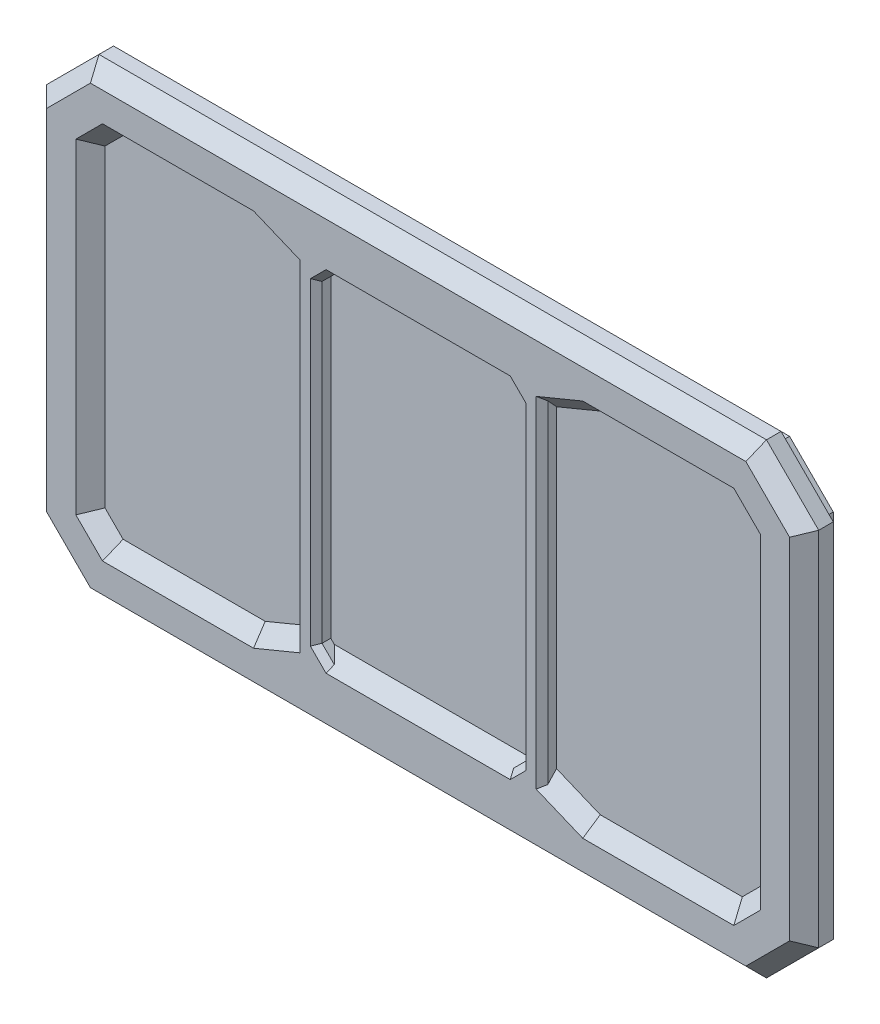
from build123d import *

# Parameters (mm, degrees)
BOSS_EXTRU_1_DEPTH      = 10
BOSS_EXTRU_2_DEPTH      = 20
ENL_V_MAT_EXTRU_1_DEPTH = 10
CHANFREIN1_SIZE         = 10
CHANFREIN2_SIZE         = 10
CHANFREIN3_SIZE         = 4


# Some blends are built 0.0001 mm under size
with BuildPart() as part:
    # Esquisse1 → Boss.-Extru.1 (new body)
    with BuildSketch(Plane.XY):
        Polygon((0, 270), (30, 300), (480, 300), (510, 270), (510, 30), (480, 0), (30, 0), (0, 30), align=None)
        Polygon((10, 265.857864376), (34.142135624, 290), (475.857864376, 290), (500, 265.857864376), (500, 34.142135624), (475.857864376, 10), (34.142135624, 10), (10, 34.142135624), align=None, mode=Mode.SUBTRACT)
    extrude(amount=BOSS_EXTRU_1_DEPTH)

    # Esquisse2 → Boss.-Extru.2 (add)
    with BuildSketch(Plane.XY.offset(10)):
        Polygon((484.142135624, 310), (25.857864376, 310), (-10, 274.142135624), (-10, 25.857864376), (25.857864376, -10), (484.142135624, -10), (520, 25.857864376), (520, 274.142135624), align=None)
    extrude(amount=BOSS_EXTRU_2_DEPTH)

    # Esquisse3 → Enlèv. mat.-Extru.1 (cut)
    with BuildSketch(Plane.XY.offset(30)):
        Polygon((42.426406871, 270), (140, 270), (170, 257.573593129), (170, 42.426406871), (140, 30), (42.426406871, 30), (30, 42.426406871), (30, 257.573593129), align=None)
        Polygon((480, 257.573593129), (467.573593129, 270), (370, 270), (340, 257.573593129), (340, 42.426406871), (370, 30), (467.573593129, 30), (480, 42.426406871), align=None)
        Polygon((197.426406871, 270), (185, 257.573593129), (185, 42.426406871), (197.426406871, 30), (312.573593129, 30), (325, 42.426406871), (325, 257.573593129), (312.573593129, 270), (255, 270), align=None)
    extrude(amount=-ENL_V_MAT_EXTRU_1_DEPTH, mode=Mode.SUBTRACT)

    # Chanfrein1
    chanfrein1_edges = [part.edges().sort_by_distance(p)[0] for p in [
        (520, 150, 30),
        (502.071067812, 7.928932188, 30),
        (255, -10, 30),
        (7.928932188, 7.928932188, 30),
        (-10, 150, 30),
        (7.928932188, 292.071067812, 30),
        (255, 310, 30),
        (502.071067812, 292.071067812, 30),
        (473.786796564, 263.786796564, 30),
        (418.786796564, 270, 30),
        (355, 263.786796564, 30),
        (355, 36.213203436, 30),
        (418.786796564, 30, 30),
        (473.786796564, 36.213203436, 30),
        (480, 150, 30),
        (155, 36.213203436, 30),
        (155, 263.786796564, 30),
        (91.213203436, 270, 30),
        (36.213203436, 263.786796564, 30),
        (30, 150, 30),
        (36.213203436, 36.213203436, 30),
        (91.213203436, 30, 30),
    ]]
    chamfer(chanfrein1_edges, length=CHANFREIN1_SIZE - 0.0001)  # a hair under: the kernel refuses the full size

    # Chanfrein2
    chanfrein2_edges = [part.edges().sort_by_distance(p)[0] for p in [
        (255, 30, 20),
        (255, 270, 20),
    ]]
    chamfer(chanfrein2_edges, length=CHANFREIN2_SIZE - 0.0001)  # a hair under: the kernel refuses the full size

    # Chanfrein3
    # the kernel refuses this chamfer: 4 mm, written as the material it takes off along each edge
    with BuildSketch(Plane(origin=(340, 21.315861156, 30), x_dir=(-0.9996219169112968, 0, 0.027495876610586605), z_dir=(0, 1, 0))) as chanfrein3_piece_1_section:
        Polygon((CHANFREIN3_SIZE * 0.999621916911, -CHANFREIN3_SIZE * 0.0274958766106), (-CHANFREIN3_SIZE * 0.0274958766106, -CHANFREIN3_SIZE * 0.999621916911), (0, 0), align=None)
    chanfrein3_piece_1 = extrude(amount=257.368277689, mode=Mode.PRIVATE)
    chanfrein3_piece_1 = split(chanfrein3_piece_1, bisect_by=Plane(origin=(318.097162936, 199.689892736, -25.095613192), z_dir=(0.27059805007309734, -0.6532814824381883, 0.707106781186548)), keep=Keep.TOP, mode=Mode.PRIVATE)
    chanfrein3_piece_1 = split(chanfrein3_piece_1, bisect_by=Plane(origin=(318.097162936, 100.310107264, -25.095613192), z_dir=(0.27059805007309695, 0.6532814824381893, 0.7071067811865472)), keep=Keep.TOP, mode=Mode.PRIVATE)
    add(chanfrein3_piece_1, mode=Mode.SUBTRACT)
    with BuildSketch(Plane(origin=(170, 278.684138844, 30), x_dir=(0.9996219169112968, 0, 0.027495876610586414), z_dir=(0, -1, 0))) as chanfrein3_piece_2_section:
        Polygon((CHANFREIN3_SIZE * 0.999621916911, -CHANFREIN3_SIZE * 0.0274958766106), (-CHANFREIN3_SIZE * 0.0274958766106, -CHANFREIN3_SIZE * 0.999621916911), (0, 0), align=None)
    chanfrein3_piece_2 = extrude(amount=257.368277689, mode=Mode.PRIVATE)
    chanfrein3_piece_2 = split(chanfrein3_piece_2, bisect_by=Plane(origin=(191.902837064, 100.310107264, -25.095613192), z_dir=(-0.27059805007309856, 0.6532814824381883, 0.7071067811865475)), keep=Keep.TOP, mode=Mode.PRIVATE)
    chanfrein3_piece_2 = split(chanfrein3_piece_2, bisect_by=Plane(origin=(191.902837064, 199.689892736, -25.095613192), z_dir=(-0.2705980500730966, -0.6532814824381884, 0.7071067811865482)), keep=Keep.TOP, mode=Mode.PRIVATE)
    add(chanfrein3_piece_2, mode=Mode.SUBTRACT)
    with BuildSketch(Plane(origin=(332.273817919, 250.299775209, 30), x_dir=(-0.019442520806006888, -0.019442520806006888, -0.999621916911297), z_dir=(-0.7071067811865476, 0.7071067811865476, 0))) as chanfrein3_piece_3_section:
        Polygon((CHANFREIN3_SIZE * 0.999621916911, -CHANFREIN3_SIZE * 0.0274958766106), (-CHANFREIN3_SIZE * 0.0274958766106, -CHANFREIN3_SIZE * 0.999621916911), (0, 0), align=None)
    chanfrein3_piece_3 = extrude(amount=38.147057033, mode=Mode.PRIVATE)
    chanfrein3_piece_3 = split(chanfrein3_piece_3, bisect_by=Plane(origin=(320.298394929, 266.355378959, 26.355278959), z_dir=(0, -0.7071067811865467, 0.7071067811865485)), keep=Keep.TOP, mode=Mode.PRIVATE)
    chanfrein3_piece_3 = split(chanfrein3_piece_3, bisect_by=Plane(origin=(320.298394929, 270, 28.707260693), z_dir=(0, -1, 0)), keep=Keep.TOP, mode=Mode.PRIVATE)
    chanfrein3_piece_3 = split(chanfrein3_piece_3, bisect_by=Plane(origin=(325, 264.003397225, 28.707260693), z_dir=(-1, 0, 0)), keep=Keep.TOP, mode=Mode.PRIVATE)
    add(chanfrein3_piece_3, mode=Mode.SUBTRACT)
    with BuildSketch(Plane(origin=(204.700224791, 277.273817919, 30), x_dir=(0.019442520806013792, -0.019442520806013792, -0.9996219169112968), z_dir=(-0.7071067811865476, -0.7071067811865476, 0))) as chanfrein3_piece_4_section:
        Polygon((CHANFREIN3_SIZE * 0.999621916911, -CHANFREIN3_SIZE * 0.0274958766106), (-CHANFREIN3_SIZE * 0.0274958766106, -CHANFREIN3_SIZE * 0.999621916911), (0, 0), align=None)
    chanfrein3_piece_4 = extrude(amount=38.147057033, mode=Mode.PRIVATE)
    chanfrein3_piece_4 = split(chanfrein3_piece_4, bisect_by=Plane(origin=(189.701605071, 270, 28.707260693), z_dir=(0, -1, 0)), keep=Keep.TOP, mode=Mode.PRIVATE)
    chanfrein3_piece_4 = split(chanfrein3_piece_4, bisect_by=Plane(origin=(189.701605071, 266.355378959, 26.355278959), z_dir=(0, -0.7071067811865467, 0.7071067811865485)), keep=Keep.TOP, mode=Mode.PRIVATE)
    chanfrein3_piece_4 = split(chanfrein3_piece_4, bisect_by=Plane(origin=(185, 264.003397225, 28.707260693), z_dir=(1, 0, 0)), keep=Keep.TOP, mode=Mode.PRIVATE)
    add(chanfrein3_piece_4, mode=Mode.SUBTRACT)
    with BuildSketch(Plane(origin=(185, 267.860325081, 30), x_dir=(0.02749587661058907, 0, -0.9996219169112965), z_dir=(0, -1, 0))) as chanfrein3_piece_5_section:
        Polygon((CHANFREIN3_SIZE * 0.999621916911, -CHANFREIN3_SIZE * 0.0274958766106), (-CHANFREIN3_SIZE * 0.0274958766106, -CHANFREIN3_SIZE * 0.999621916911), (0, 0), align=None)
    chanfrein3_piece_5 = extrude(amount=235.720650161, mode=Mode.PRIVATE)
    chanfrein3_piece_5 = split(chanfrein3_piece_5, bisect_by=Plane(origin=(130.558397351, 203.13199048, 28.675713426), z_dir=(0.7071067811865476, -0.7071067811865476, 0)), keep=Keep.TOP, mode=Mode.PRIVATE)
    chanfrein3_piece_5 = split(chanfrein3_piece_5, bisect_by=Plane(origin=(130.558397351, 96.86800952, 28.675713426), z_dir=(0.7071067811865475, 0.7071067811865477, 0)), keep=Keep.TOP, mode=Mode.PRIVATE)
    add(chanfrein3_piece_5, mode=Mode.SUBTRACT)
    with BuildSketch(Plane(origin=(177.726182081, 49.700224791, 30), x_dir=(0.01944252080601465, 0.019442520806014656, -0.9996219169112968), z_dir=(0.7071067811865477, -0.7071067811865475, 0))) as chanfrein3_piece_6_section:
        Polygon((CHANFREIN3_SIZE * 0.999621916911, -CHANFREIN3_SIZE * 0.0274958766106), (-CHANFREIN3_SIZE * 0.0274958766106, -CHANFREIN3_SIZE * 0.999621916911), (0, 0), align=None)
    chanfrein3_piece_6 = extrude(amount=38.147057033, mode=Mode.PRIVATE)
    chanfrein3_piece_6 = split(chanfrein3_piece_6, bisect_by=Plane(origin=(185, 35.996602775, 28.707260693), z_dir=(1, 0, 0)), keep=Keep.TOP, mode=Mode.PRIVATE)
    chanfrein3_piece_6 = split(chanfrein3_piece_6, bisect_by=Plane(origin=(189.701605071, 30, 28.707260693), z_dir=(0, 1, 0)), keep=Keep.TOP, mode=Mode.PRIVATE)
    chanfrein3_piece_6 = split(chanfrein3_piece_6, bisect_by=Plane(origin=(189.701605071, 33.644621041, 26.355278959), z_dir=(0, 0.7071067811865475, 0.7071067811865477)), keep=Keep.TOP, mode=Mode.PRIVATE)
    add(chanfrein3_piece_6, mode=Mode.SUBTRACT)
    with BuildSketch(Plane(origin=(305.299775209, 22.726182081, 30), x_dir=(-0.0194425208060121, 0.01944252080601203, -0.9996219169112968), z_dir=(0.7071067811865464, 0.7071067811865488, 0))) as chanfrein3_piece_7_section:
        Polygon((CHANFREIN3_SIZE * 0.999621916911, -CHANFREIN3_SIZE * 0.0274958766106), (-CHANFREIN3_SIZE * 0.0274958766106, -CHANFREIN3_SIZE * 0.999621916911), (0, 0), align=None)
    chanfrein3_piece_7 = extrude(amount=38.147057033, mode=Mode.PRIVATE)
    chanfrein3_piece_7 = split(chanfrein3_piece_7, bisect_by=Plane(origin=(325, 35.996602775, 28.707260693), z_dir=(-1, 0, 0)), keep=Keep.TOP, mode=Mode.PRIVATE)
    chanfrein3_piece_7 = split(chanfrein3_piece_7, bisect_by=Plane(origin=(320.298394929, 33.644621041, 26.355278959), z_dir=(0, 0.7071067811865475, 0.7071067811865477)), keep=Keep.TOP, mode=Mode.PRIVATE)
    chanfrein3_piece_7 = split(chanfrein3_piece_7, bisect_by=Plane(origin=(320.298394929, 30, 28.707260693), z_dir=(0, 1, 0)), keep=Keep.TOP, mode=Mode.PRIVATE)
    add(chanfrein3_piece_7, mode=Mode.SUBTRACT)
    with BuildSketch(Plane(origin=(325, 32.139674919, 30), x_dir=(-0.02749587661058217, 0, -0.9996219169112968), z_dir=(0, 1, 0))) as chanfrein3_piece_8_section:
        Polygon((CHANFREIN3_SIZE * 0.999621916911, -CHANFREIN3_SIZE * 0.0274958766106), (-CHANFREIN3_SIZE * 0.0274958766106, -CHANFREIN3_SIZE * 0.999621916911), (0, 0), align=None)
    chanfrein3_piece_8 = extrude(amount=235.720650161, mode=Mode.PRIVATE)
    chanfrein3_piece_8 = split(chanfrein3_piece_8, bisect_by=Plane(origin=(379.441602649, 203.13199048, 28.675713426), z_dir=(-0.7071067811865476, -0.7071067811865476, 0)), keep=Keep.TOP, mode=Mode.PRIVATE)
    chanfrein3_piece_8 = split(chanfrein3_piece_8, bisect_by=Plane(origin=(379.441602649, 96.86800952, 28.675713426), z_dir=(-0.7071067811865488, 0.7071067811865464, 0)), keep=Keep.TOP, mode=Mode.PRIVATE)
    add(chanfrein3_piece_8, mode=Mode.SUBTRACT)
    with BuildSketch(Plane(origin=(332.273817919, 250.299775209, 30), x_dir=(-0.019442520806006888, -0.019442520806006888, -0.999621916911297), z_dir=(-0.7071067811865476, 0.7071067811865476, 0))) as chanfrein3_piece_9a_section:
        Polygon((CHANFREIN3_SIZE * 0.999621916911, -CHANFREIN3_SIZE * 0.0274958766106), (-CHANFREIN3_SIZE * 0.0274958766106, -CHANFREIN3_SIZE * 0.999621916911), (0, 0), align=None)
    chanfrein3_piece_9a = extrude(amount=38.147057033, mode=Mode.PRIVATE)
    chanfrein3_piece_9a = split(chanfrein3_piece_9a, bisect_by=Plane(origin=(325, 255.42873567, 28.7276275), z_dir=(1, 0, 0)), keep=Keep.TOP, mode=Mode.PRIVATE)
    with BuildSketch(Plane(origin=(325, 32.139674919, 30), x_dir=(-0.02749587661058217, 0, -0.9996219169112968), z_dir=(0, 1, 0))) as chanfrein3_piece_9b_section:
        Polygon((CHANFREIN3_SIZE * 0.999621916911, -CHANFREIN3_SIZE * 0.0274958766106), (-CHANFREIN3_SIZE * 0.0274958766106, -CHANFREIN3_SIZE * 0.999621916911), (0, 0), align=None)
    chanfrein3_piece_9b = extrude(amount=235.720650161, mode=Mode.PRIVATE)
    chanfrein3_piece_9b = split(chanfrein3_piece_9b, bisect_by=Plane(origin=(323.483356746, 259.090236382, 28.7276275), z_dir=(0.7071067811865476, 0.7071067811865476, 0)), keep=Keep.TOP, mode=Mode.PRIVATE)
    chanfrein3_piece_9 = chanfrein3_piece_9a & chanfrein3_piece_9b
    add(chanfrein3_piece_9, mode=Mode.SUBTRACT)
    with BuildSketch(Plane(origin=(204.700224791, 277.273817919, 30), x_dir=(0.019442520806013792, -0.019442520806013792, -0.9996219169112968), z_dir=(-0.7071067811865476, -0.7071067811865476, 0))) as chanfrein3_piece_10a_section:
        Polygon((CHANFREIN3_SIZE * 0.999621916911, -CHANFREIN3_SIZE * 0.0274958766106), (-CHANFREIN3_SIZE * 0.0274958766106, -CHANFREIN3_SIZE * 0.999621916911), (0, 0), align=None)
    chanfrein3_piece_10a = extrude(amount=38.147057033, mode=Mode.PRIVATE)
    chanfrein3_piece_10a = split(chanfrein3_piece_10a, bisect_by=Plane(origin=(185, 255.42873567, 28.7276275), z_dir=(-1, 0, 0)), keep=Keep.TOP, mode=Mode.PRIVATE)
    with BuildSketch(Plane(origin=(185, 267.860325081, 30), x_dir=(0.02749587661058907, 0, -0.9996219169112965), z_dir=(0, -1, 0))) as chanfrein3_piece_10b_section:
        Polygon((CHANFREIN3_SIZE * 0.999621916911, -CHANFREIN3_SIZE * 0.0274958766106), (-CHANFREIN3_SIZE * 0.0274958766106, -CHANFREIN3_SIZE * 0.999621916911), (0, 0), align=None)
    chanfrein3_piece_10b = extrude(amount=235.720650161, mode=Mode.PRIVATE)
    chanfrein3_piece_10b = split(chanfrein3_piece_10b, bisect_by=Plane(origin=(186.516643254, 259.090236382, 28.7276275), z_dir=(-0.7071067811865476, 0.7071067811865476, 0)), keep=Keep.TOP, mode=Mode.PRIVATE)
    chanfrein3_piece_10 = chanfrein3_piece_10a & chanfrein3_piece_10b
    add(chanfrein3_piece_10, mode=Mode.SUBTRACT)
    with BuildSketch(Plane(origin=(185, 267.860325081, 30), x_dir=(0.02749587661058907, 0, -0.9996219169112965), z_dir=(0, -1, 0))) as chanfrein3_piece_11a_section:
        Polygon((CHANFREIN3_SIZE * 0.999621916911, -CHANFREIN3_SIZE * 0.0274958766106), (-CHANFREIN3_SIZE * 0.0274958766106, -CHANFREIN3_SIZE * 0.999621916911), (0, 0), align=None)
    chanfrein3_piece_11a = extrude(amount=235.720650161, mode=Mode.PRIVATE)
    chanfrein3_piece_11a = split(chanfrein3_piece_11a, bisect_by=Plane(origin=(186.516643254, 40.909763618, 28.7276275), z_dir=(-0.7071067811865475, -0.7071067811865477, 0)), keep=Keep.TOP, mode=Mode.PRIVATE)
    with BuildSketch(Plane(origin=(177.726182081, 49.700224791, 30), x_dir=(0.01944252080601465, 0.019442520806014656, -0.9996219169112968), z_dir=(0.7071067811865477, -0.7071067811865475, 0))) as chanfrein3_piece_11b_section:
        Polygon((CHANFREIN3_SIZE * 0.999621916911, -CHANFREIN3_SIZE * 0.0274958766106), (-CHANFREIN3_SIZE * 0.0274958766106, -CHANFREIN3_SIZE * 0.999621916911), (0, 0), align=None)
    chanfrein3_piece_11b = extrude(amount=38.147057033, mode=Mode.PRIVATE)
    chanfrein3_piece_11b = split(chanfrein3_piece_11b, bisect_by=Plane(origin=(185, 44.57126433, 28.7276275), z_dir=(-1, 0, 0)), keep=Keep.TOP, mode=Mode.PRIVATE)
    chanfrein3_piece_11 = chanfrein3_piece_11a & chanfrein3_piece_11b
    add(chanfrein3_piece_11, mode=Mode.SUBTRACT)
    with BuildSketch(Plane(origin=(325, 32.139674919, 30), x_dir=(-0.02749587661058217, 0, -0.9996219169112968), z_dir=(0, 1, 0))) as chanfrein3_piece_12a_section:
        Polygon((CHANFREIN3_SIZE * 0.999621916911, -CHANFREIN3_SIZE * 0.0274958766106), (-CHANFREIN3_SIZE * 0.0274958766106, -CHANFREIN3_SIZE * 0.999621916911), (0, 0), align=None)
    chanfrein3_piece_12a = extrude(amount=235.720650161, mode=Mode.PRIVATE)
    chanfrein3_piece_12a = split(chanfrein3_piece_12a, bisect_by=Plane(origin=(323.483356746, 40.909763618, 28.7276275), z_dir=(0.7071067811865488, -0.7071067811865464, 0)), keep=Keep.TOP, mode=Mode.PRIVATE)
    with BuildSketch(Plane(origin=(305.299775209, 22.726182081, 30), x_dir=(-0.0194425208060121, 0.01944252080601203, -0.9996219169112968), z_dir=(0.7071067811865464, 0.7071067811865488, 0))) as chanfrein3_piece_12b_section:
        Polygon((CHANFREIN3_SIZE * 0.999621916911, -CHANFREIN3_SIZE * 0.0274958766106), (-CHANFREIN3_SIZE * 0.0274958766106, -CHANFREIN3_SIZE * 0.999621916911), (0, 0), align=None)
    chanfrein3_piece_12b = extrude(amount=38.147057033, mode=Mode.PRIVATE)
    chanfrein3_piece_12b = split(chanfrein3_piece_12b, bisect_by=Plane(origin=(325, 44.57126433, 28.7276275), z_dir=(1, 0, 0)), keep=Keep.TOP, mode=Mode.PRIVATE)
    chanfrein3_piece_12 = chanfrein3_piece_12a & chanfrein3_piece_12b
    add(chanfrein3_piece_12, mode=Mode.SUBTRACT)


solid = part.part
